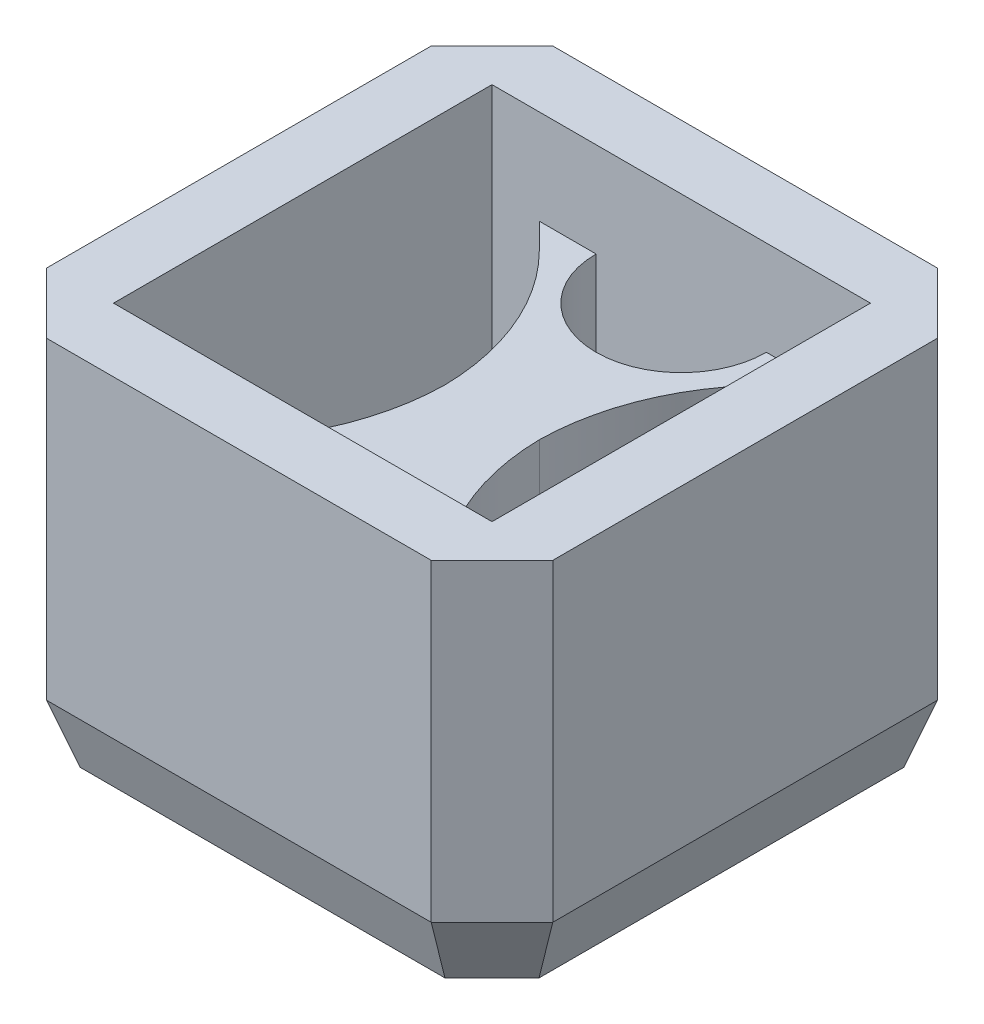
from build123d import *

# Parameters (mm, degrees)
SKETCH1_W           = 8
SKETCH1_H           = 8
BOSS_EXTRUDE1_DEPTH = 8
BOSS_EXTRUDE2_DEPTH = 6
SKETCH3_OUTSIDE_W   = 19.406
SKETCH3_OUTSIDE_H   = 19.406
SKETCH3_OUTSIDE_W_2 = 10.7
SKETCH3_OUTSIDE_H_2 = 10.7
CUT_EXTRUDE2_DEPTH  = 13.354246922
CHAMFER1_SIZE       = 0.5
CHAMFER1_SIZE2      = 1.37373871
FILLET2_R           = 5
SKETCH6_W           = 8
SKETCH6_H           = 4
CUT_EXTRUDE4_DEPTH  = 12.011130732
MIRROR1_DEPTH       = 6
CUT_EXTRUDE5_DEPTH  = 10.656345064


# Read off the part's stored shape, not the designer's step: Mirror1
with BuildPart() as part:
    # Sketch1 → Boss-Extrude1 (new body)
    with BuildSketch(Plane(origin=(0, 0, 0), x_dir=(1, 0, 0), z_dir=(0, 1, 0))):
        Polygon((6.656854249, -2.757359313), (6.656854249, 2.757359313), (2.757359313, 6.656854249), (-2.757359313, 6.656854249), (-6.656854249, 2.757359313), (-6.656854249, -2.757359313), (-2.757359313, -6.656854249), (2.757359313, -6.656854249), align=None)
        Rectangle(SKETCH1_W, SKETCH1_H, mode=Mode.SUBTRACT)
    extrude(amount=BOSS_EXTRUDE1_DEPTH)

    # Sketch2 → Boss-Extrude2 (add)
    with BuildSketch(Plane.XZ):
        with BuildLine():
            Line((1, 2), (3, 4))
            Line((3, 4), (1.8, 4))
            ThreePointArc((1.8, 4), (0, 2.2), (-1.8, 4))
            Line((-1.8, 4), (-3, 4))
            Line((-3, 4), (-1, 2))
            Line((-1, 2), (-1, -4))
            Line((-1, -4), (1, -4))
            Line((1, -4), (1, 2))
        make_face()
    extrude(amount=-BOSS_EXTRUDE2_DEPTH)

    # Sketch3 outside → Cut-Extrude2 (cut, through all)
    with BuildSketch(Plane(origin=(0, 8, 0), x_dir=(1, 0, 0), z_dir=(0, 1, 0))):
        Rectangle(SKETCH3_OUTSIDE_W, SKETCH3_OUTSIDE_H)
        Rectangle(SKETCH3_OUTSIDE_W_2, SKETCH3_OUTSIDE_H_2, mode=Mode.SUBTRACT)
    extrude(amount=-CUT_EXTRUDE2_DEPTH, mode=Mode.SUBTRACT)

    # Chamfer1
    chamfer1_edges = [part.edges().sort_by_distance(p)[0] for p in [
        (-4.707106781, 0, 4.707106781),
        (-4.707106781, 0, -4.707106781),
        (4.707106781, 0, -4.707106781),
        (4.707106781, 0, 4.707106781),
        (5.35, 0, 0),
        (0, 0, -5.35),
        (-5.35, 0, 0),
        (0, 0, 5.35),
    ]]
    chamfer1_side = [part.faces().sort_by_distance(p)[0] for p in [
        (0, 0, -0.050506984),
    ]]
    chamfer(chamfer1_edges, length=CHAMFER1_SIZE, length2=CHAMFER1_SIZE2, reference=chamfer1_side[0])

    # Fillet2
    fillet2_edges = [part.edges().sort_by_distance(p)[0] for p in [
        (-1, 3, 2),
        (1, 3, 2),
    ]]
    fillet(fillet2_edges, radius=FILLET2_R)

    # Sketch6 → Cut-Extrude4 (cut, through all)
    with BuildSketch(Plane(origin=(0, 8, 0), x_dir=(1, 0, 0), z_dir=(0, 1, 0))):
        with Locations((0, 2)):
            Rectangle(SKETCH6_W, SKETCH6_H)
    extrude(amount=-CUT_EXTRUDE4_DEPTH, mode=Mode.SUBTRACT)

    # Mirror1 outline → Mirror1 (add)
    with BuildSketch(Plane(origin=(0, 0, 0), x_dir=(1, 0, 0), z_dir=(0, 1, 0))):
        with BuildLine():
            Line((-3, 4), (-2.463953695, 3.463953695))
            ThreePointArc((-2.463953695, 3.463953695), (-1.39390492, 1.874854522), (-1, 0))
            Line((-1, 0), (1, 0))
            ThreePointArc((1, 0), (1.39390492, 1.874854522), (2.463953695, 3.463953695))
            Line((2.463953695, 3.463953695), (3, 4))
            Line((3, 4), (1.8, 4))
            ThreePointArc((1.8, 4), (0, 2.2), (-1.8, 4))
            Line((-1.8, 4), (-3, 4))
        make_face()
        with BuildLine():
            Line((1, -4), (1, -2.503337045))
            ThreePointArc((1, -2.503337045), (0, -2.2), (-1, -2.503337045))
            Line((-1, -2.503337045), (-1, -4))
            Line((-1, -4), (1, -4))
        make_face()
    extrude(amount=MIRROR1_DEPTH)

    # Sketch8 → Cut-Extrude5 (cut, through all)
    with BuildSketch(Plane(origin=(0, 6, 0), x_dir=(1, 0, 0), z_dir=(0, 1, 0))):
        with BuildLine():
            Line((1.8, -4), (-1.8, -4))
            ThreePointArc((-1.8, -4), (0, -2.2), (1.8, -4))
        make_face()
    extrude(amount=-CUT_EXTRUDE5_DEPTH, mode=Mode.SUBTRACT)


solid = part.part
